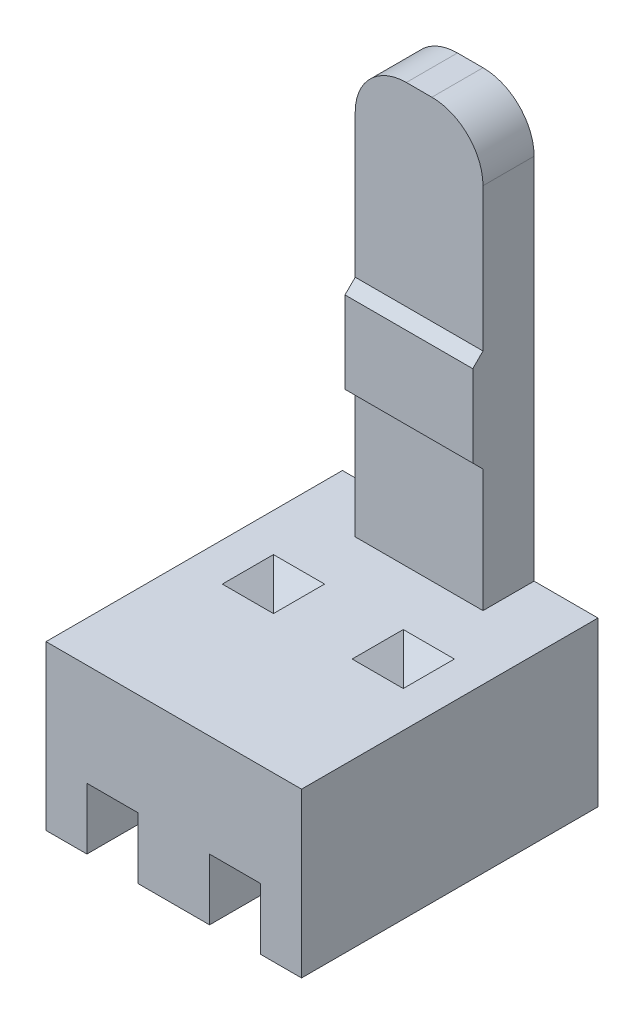
from build123d import *

# Parameters (mm, degrees)
EXTRUDE_1_DEPTH                  = 5.8
SKETCH_2_W                       = 2.5
SKETCH_2_H                       = 1
EXTRUDE_2_DEPTH                  = 8.2
SKETCH_3_W                       = 2.5
SKETCH_3_H                       = 2
EXTRUDE_3_DEPTH                  = 0.2
CHAMFER_1_SIZE                   = 0.2
FILLET_1_R                       = 1
SKETCH_4_W                       = 1
SKETCH_4_H                       = 1
CUT_EXTRUDE_1_DEPTH              = 0.5
CUT_EXTRUDE_1_DRAFT              = -44
PATTERN_LINEAR_1_COPY_1_SKETCH_W = 1
PATTERN_LINEAR_1_COPY_1_SKETCH_H = 1
PATTERN_LINEAR_1_COPY_1_DEPTH    = 0.5
PATTERN_LINEAR_1_COPY_1_DRAFT    = -44


with BuildPart() as part:
    # Эскиз1 → Бобышка-Вытянуть1 (new body)
    with BuildSketch(Plane.XY):
        Polygon((0, 0), (0, 3.2), (5, 3.2), (5, 0), (4.2, 0), (4.2, 1.2), (3.2, 1.2), (3.2, 0), (1.8, 0), (1.8, 1.2), (0.8, 1.2), (0.8, 0), align=None)
    extrude(amount=EXTRUDE_1_DEPTH)

    # Эскиз2 → Бобышка-Вытянуть2 (add)
    with BuildSketch(Plane(origin=(0, 3.2, 0), x_dir=(1, 0, 0), z_dir=(0, 1, 0))):
        with Locations((2.5, -0.5)):
            Rectangle(SKETCH_2_W, SKETCH_2_H)
    extrude(amount=EXTRUDE_2_DEPTH)

    # Эскиз3 → Бобышка-Вытянуть3 (add)
    with BuildSketch(Plane.XY.offset(1)):
        with Locations((2.5, 6.6)):
            Rectangle(SKETCH_3_W, SKETCH_3_H)
    extrude(amount=EXTRUDE_3_DEPTH)

    # Фаска1
    chamfer_1_edges = [part.edges().sort_by_distance(p)[0] for p in [
        (2.5, 5.6, 1.2),
        (2.5, 7.6, 1.2),
    ]]
    chamfer(chamfer_1_edges, length=CHAMFER_1_SIZE - 0.0001)  # a hair under: the kernel refuses the full size

    # Скругление1
    fillet_1_edges = [part.edges().sort_by_distance(p)[0] for p in [
        (1.25, 11.4, 0.5),
        (3.75, 11.4, 0.5),
    ]]
    fillet(fillet_1_edges, radius=FILLET_1_R)


with BuildPart() as cut_extrude_1_tool:
    # Эскиз4 → Вырез-Вытянуть1 (with draft: the straight prism first)
    with BuildSketch(Plane(origin=(0, 3.2, 0), x_dir=(1, 0, 0), z_dir=(0, 1, 0))):
        with Locations((1.25, -2.6)):
            Rectangle(SKETCH_4_W, SKETCH_4_H)
    extrude(amount=-CUT_EXTRUDE_1_DEPTH)
    # Вырез-Вытянуть1: the draft: its side faces are tilted about the plane it starts from
    cut_extrude_1_sides = [cut_extrude_1_tool.faces().sort_by_distance(p)[0] for p in [
        (0.75, 2.95, 2.6),
        (1.25, 2.95, 3.1),
        (1.75, 2.95, 2.6),
        (1.25, 2.95, 2.1),
    ]]
    draft(cut_extrude_1_sides, Plane(origin=(0, 3.2, 0), x_dir=(1, 0, 0), z_dir=(0, 1, 0)), CUT_EXTRUDE_1_DRAFT)


with BuildPart() as part_1:
    add(part.part)

    # Вырез-Вытянуть1: cut by cut_extrude_1_tool
    add(cut_extrude_1_tool.part, mode=Mode.SUBTRACT)


with BuildPart() as pattern_linear_1_copy_1_tool:
    # Линейный массив1 copy 1 sketch → Линейный массив1 copy 1 (with draft: the straight prism first)
    with BuildSketch(Plane(origin=(2.54, 3.2, 0), x_dir=(1, 0, 0), z_dir=(0, 1, 0))):
        with Locations((1.25, -2.6)):
            Rectangle(PATTERN_LINEAR_1_COPY_1_SKETCH_W, PATTERN_LINEAR_1_COPY_1_SKETCH_H)
    extrude(amount=-PATTERN_LINEAR_1_COPY_1_DEPTH)
    # Линейный массив1 copy 1: the draft: its side faces are tilted about the plane it starts from
    pattern_linear_1_copy_1_sides = [pattern_linear_1_copy_1_tool.faces().sort_by_distance(p)[0] for p in [
        (3.29, 2.95, 2.6),
        (3.79, 2.95, 3.1),
        (4.29, 2.95, 2.6),
        (3.79, 2.95, 2.1),
    ]]
    draft(pattern_linear_1_copy_1_sides, Plane(origin=(2.54, 3.2, 0), x_dir=(1, 0, 0), z_dir=(0, 1, 0)), PATTERN_LINEAR_1_COPY_1_DRAFT)


with BuildPart() as part_2:
    add(part_1.part)

    # Линейный массив1 copy 1: cut by pattern_linear_1_copy_1_tool
    add(pattern_linear_1_copy_1_tool.part, mode=Mode.SUBTRACT)


solid = part_2.part
